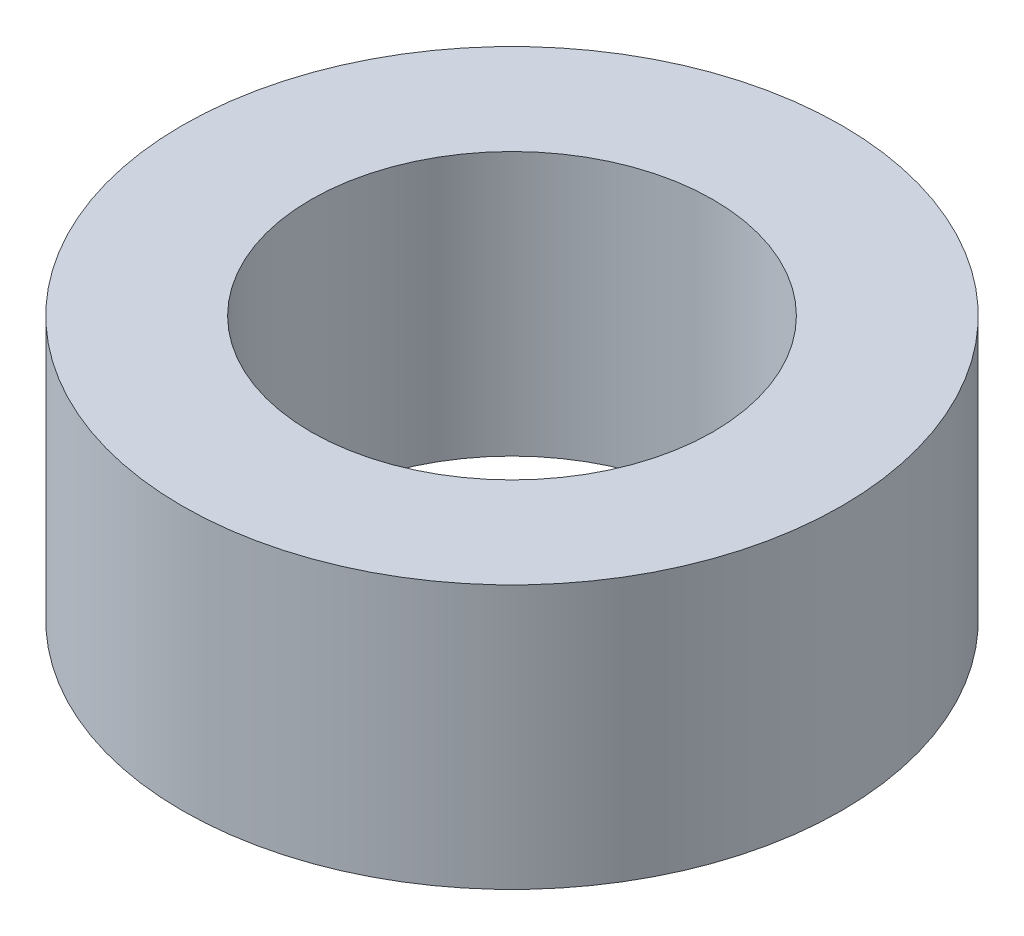
from build123d import *

# Parameters (mm, degrees)
SKETCH1_R           = 5
SKETCH1_R_2         = 3.05
BOSS_EXTRUDE1_DEPTH = 2


with BuildPart() as part:
    # Sketch1 → Boss-Extrude1 (new, symmetric)
    with BuildSketch(Plane(origin=(0, 0, 0), x_dir=(1, 0, 0), z_dir=(0, 1, 0))):
        Circle(SKETCH1_R)
        Circle(SKETCH1_R_2, mode=Mode.SUBTRACT)
    extrude(amount=BOSS_EXTRUDE1_DEPTH, both=True)


solid = part.part
